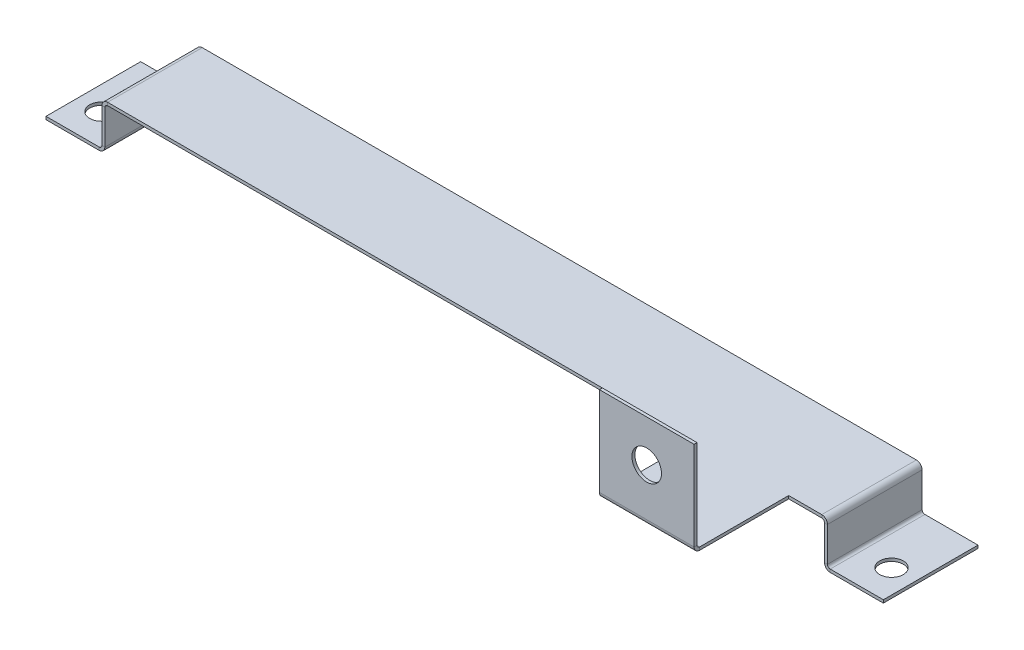
from build123d import *

# Parameters (mm, degrees)
SKETCH1_W                    = 14.25702
SKETCH1_H                    = 25.4
SKETCH1_R                    = 3.175
BASE_FLANGE1_DEPTH           = 0.79375
EDGE_FLANGE1_DEPTH           = 25.4
EDGE_FLANGE2_DEPTH           = 25.4
EDGE_FLANGE3_DEPTH           = 25.4
EDGE_FLANGE4_STRIP_W         = 4.6482
EDGE_FLANGE4_STRIP_H         = 0.79375
EDGE_FLANGE4_STRIP_CUT_DEPTH = 25.4
EDGE_FLANGE4_DEPTH           = 25.4
SKETCH16_R                   = 3.175
CUT_EXTRUDE1_DEPTH           = 220.30417026
SKETCH19_W                   = 25.4
SKETCH19_H                   = 25.4
TAB1_DEPTH                   = 0.79375
EDGE_FLANGE5_STRIP_W         = 4.6482
EDGE_FLANGE5_STRIP_H         = 0.79375
EDGE_FLANGE5_STRIP_CUT_DEPTH = 25.4
EDGE_FLANGE5_DEPTH           = 25.4
SKETCH25_R                   = 3.96875
CUT_EXTRUDE2_DEPTH           = 228.075600106


# Sheet-metal steps are written as plain solids
with BuildPart() as part:
    # Sketch1 → Base-Flange1 (new body)
    with BuildSketch(Plane(origin=(0, 0, 0), x_dir=(1, 0, 0), z_dir=(0, 1, 0))):
        with Locations((-0.77851, 4.160748346)):
            Rectangle(SKETCH1_W, SKETCH1_H)
        with Locations(Location((0, 0, 0), (0, 0, 270))):
            Circle(SKETCH1_R, mode=Mode.SUBTRACT)
    extrude(amount=-BASE_FLANGE1_DEPTH)

    # Edge-Flange1 section (across the edge) → Edge-Flange1 (add)
    with BuildSketch(Plane(origin=(-8.64362, 0, -16.860748346), x_dir=(1, 0, 0), z_dir=(0, 0, 1))):
        with BuildLine():
            Line((-0.79375, 0.7366), (-0.79375, 9.9949))
            Line((-0.79375, 9.9949), (0, 9.9949))
            Line((0, 9.9949), (0, 0.7366))
            ThreePointArc((0, 0.7366), (0.215745145, 0.215745145), (0.7366, 0))
            Line((0.7366, 0), (0.7366, -0.79375))
            ThreePointArc((0.7366, -0.79375), (-0.345520863, -0.345520863), (-0.79375, 0.7366))
        make_face()
    extrude(amount=EDGE_FLANGE1_DEPTH)

    # Edge-Flange2 section (across the edge) → Edge-Flange2 (add)
    with BuildSketch(Plane(origin=(-9.43737, 10.7315, 8.539251654), x_dir=(0, -1, 0), z_dir=(0, 0, -1))):
        with BuildLine():
            Line((-0.79375, 0.7366), (-0.79375, 192.38595))
            Line((-0.79375, 192.38595), (0, 192.38595))
            Line((0, 192.38595), (0, 0.7366))
            ThreePointArc((0, 0.7366), (0.215745145, 0.215745145), (0.7366, 0))
            Line((0.7366, 0), (0.7366, -0.79375))
            ThreePointArc((0.7366, -0.79375), (-0.345520863, -0.345520863), (-0.79375, 0.7366))
        make_face()
    extrude(amount=EDGE_FLANGE2_DEPTH)

    # Edge-Flange3 section (across the edge) → Edge-Flange3 (add)
    with BuildSketch(Plane(origin=(-202.55992, 10.7315, 8.539251654), x_dir=(1, 0, 0), z_dir=(0, 0, -1))):
        with BuildLine():
            Line((-0.79375, 0.7366), (-0.79375, 11.52525))
            Line((-0.79375, 11.52525), (0, 11.52525))
            Line((0, 11.52525), (0, 0.7366))
            ThreePointArc((0, 0.7366), (0.215745145, 0.215745145), (0.7366, 0))
            Line((0.7366, 0), (0.7366, -0.79375))
            ThreePointArc((0.7366, -0.79375), (-0.345520863, -0.345520863), (-0.79375, 0.7366))
        make_face()
    extrude(amount=EDGE_FLANGE3_DEPTH)

    # Edge-Flange4 strip (across the edge) → Edge-Flange4 strip cut (cut)
    with BuildSketch(Plane(origin=(-203.35367, -0.79375, -16.860748346), x_dir=(0, 1, 0), z_dir=(0, 0, 1))):
        with Locations((-0.79375, -0.396875)):
            Rectangle(EDGE_FLANGE4_STRIP_W, EDGE_FLANGE4_STRIP_H)
    extrude(amount=EDGE_FLANGE4_STRIP_CUT_DEPTH, mode=Mode.SUBTRACT)

    # Edge-Flange4 section (across the edge) → Edge-Flange4 (add)
    with BuildSketch(Plane(origin=(-203.35367, -0.79375, -16.860748346), x_dir=(0, 1, 0), z_dir=(0, 0, 1))):
        with BuildLine():
            Line((0, 0.7366), (0, 14.99743))
            Line((0, 14.99743), (0.79375, 14.99743))
            Line((0.79375, 14.99743), (0.79375, 0.7366))
            ThreePointArc((0.79375, 0.7366), (1.009495145, 0.215745145), (1.53035, 0))
            Line((1.53035, 0), (1.53035, -0.79375))
            ThreePointArc((1.53035, -0.79375), (0.448229137, -0.345520863), (0, 0.7366))
        make_face()
    extrude(amount=EDGE_FLANGE4_DEPTH)

    # Sketch16 → Cut-Extrude1 (cut, through all)
    with BuildSketch(Plane(origin=(0, 0, 0), x_dir=(1, 0, 0), z_dir=(0, 1, 0))):
        with Locations(Location((-211.998031426, 0, 0), (0, 0, 180))):
            Circle(SKETCH16_R)
    extrude(amount=-CUT_EXTRUDE1_DEPTH, mode=Mode.SUBTRACT)

    # Sketch19 → Tab1 (add)
    with BuildSketch(Plane(origin=(0, 11.52525, 0), x_dir=(1, 0, 0), z_dir=(0, 1, 0))):
        with Locations((-31.75, -21.239251654)):
            Rectangle(SKETCH19_W, SKETCH19_H)
    extrude(amount=-TAB1_DEPTH)

    # Edge-Flange5 strip (across the edge) → Edge-Flange5 strip cut (cut)
    with BuildSketch(Plane(origin=(-44.45, 11.52525, 33.939251654), x_dir=(0, 0, -1), z_dir=(1, 0, 0))):
        with Locations((-0.79375, -0.396875)):
            Rectangle(EDGE_FLANGE5_STRIP_W, EDGE_FLANGE5_STRIP_H)
    extrude(amount=EDGE_FLANGE5_STRIP_CUT_DEPTH, mode=Mode.SUBTRACT)

    # Edge-Flange5 section (across the edge) → Edge-Flange5 (add)
    with BuildSketch(Plane(origin=(-44.45, 11.52525, 33.939251654), x_dir=(0, 0, -1), z_dir=(1, 0, 0))):
        with BuildLine():
            Line((0, 0.7366), (0, 24.60625))
            Line((0, 24.60625), (0.79375, 24.60625))
            Line((0.79375, 24.60625), (0.79375, 0.7366))
            ThreePointArc((0.79375, 0.7366), (1.009495145, 0.215745145), (1.53035, 0))
            Line((1.53035, 0), (1.53035, -0.79375))
            ThreePointArc((1.53035, -0.79375), (0.448229137, -0.345520863), (0, 0.7366))
        make_face()
    extrude(amount=EDGE_FLANGE5_DEPTH)

    # Sketch25 → Cut-Extrude2 (cut, through all)
    with BuildSketch(Plane.XY.offset(33.939251654)):
        with Locations((-31.75, 24.96185)):
            Circle(SKETCH25_R)
    extrude(amount=-CUT_EXTRUDE2_DEPTH, mode=Mode.SUBTRACT)


solid = part.part
